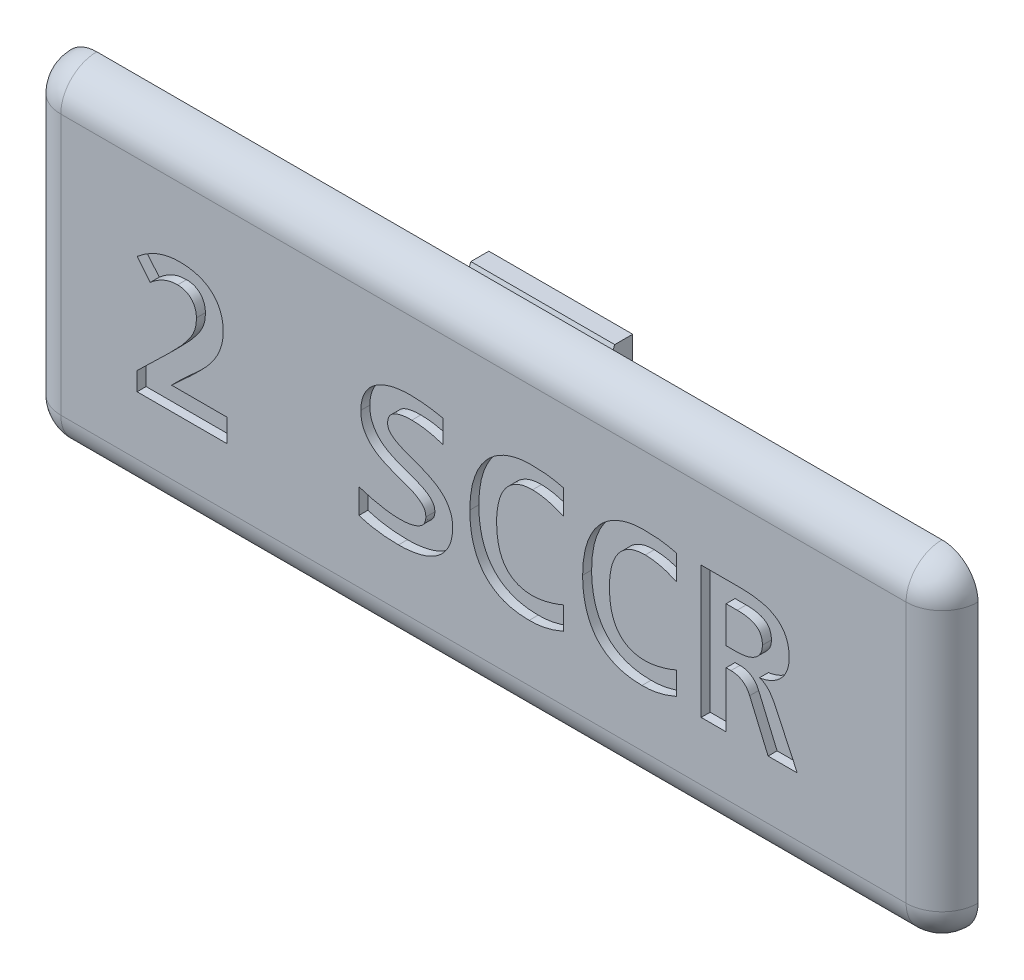
from build123d import *

# Parameters (mm, degrees)
BOSS_EXTRUDE1_DEPTH = 2
SKETCH3_W           = 47.5
SKETCH3_H           = 15
BOSS_EXTRUDE2_DEPTH = 1
SKETCH4_W           = 9.5
SKETCH4_H           = 5
CUT_EXTRUDE1_DEPTH  = 1
SKETCH5_W           = 8
SKETCH5_H           = 8.5
CUT_EXTRUDE2_DEPTH  = 1
SKETCH6_W           = 4
SKETCH6_H           = 1.75
BOSS_EXTRUDE3_DEPTH = 1.75
BOSS_EXTRUDE4_DEPTH = 4
FILLET1_R           = 2
CUT_EXTRUDE3_DEPTH  = 0.5


with BuildPart() as part:
    # Sketch1 → Boss-Extrude1 (new body)
    with BuildSketch(Plane.XY):
        with BuildLine():
            Line((25.5, -7.25), (25.5, 7.25))
            ThreePointArc((25.5, 7.25), (24.914213562, 8.664213562), (23.5, 9.25))
            Line((23.5, 9.25), (-23.5, 9.25))
            ThreePointArc((-23.5, 9.25), (-24.914213562, 8.664213562), (-25.5, 7.25))
            Line((-25.5, 7.25), (-25.5, -7.25))
            ThreePointArc((-25.5, -7.25), (-24.914213562, -8.664213562), (-23.5, -9.25))
            Line((-23.5, -9.25), (23.5, -9.25))
            ThreePointArc((23.5, -9.25), (24.914213562, -8.664213562), (25.5, -7.25))
        make_face()
    extrude(amount=BOSS_EXTRUDE1_DEPTH)

    # Sketch3 → Boss-Extrude2 (add)
    with BuildSketch(Plane(origin=(0, 0, 0), x_dir=(-1, 0, 0), z_dir=(0, 0, -1))):
        Rectangle(SKETCH3_W, SKETCH3_H)
    extrude(amount=BOSS_EXTRUDE2_DEPTH)

    # Sketch4 → Cut-Extrude1 (cut)
    with BuildSketch(Plane(origin=(0, 0, -1), x_dir=(-1, 0, 0), z_dir=(0, 0, -1))):
        with Locations((-13.5, -5)):
            Rectangle(SKETCH4_W, SKETCH4_H)
    extrude(amount=-CUT_EXTRUDE1_DEPTH, mode=Mode.SUBTRACT)

    # Sketch5 → Cut-Extrude2 (cut)
    with BuildSketch(Plane(origin=(0, 0, -1), x_dir=(-1, 0, 0), z_dir=(0, 0, -1))):
        with Locations((-17, 3.5)):
            Rectangle(SKETCH5_W, SKETCH5_H)
    extrude(amount=-CUT_EXTRUDE2_DEPTH, mode=Mode.SUBTRACT)

    # Sketch6 → Boss-Extrude3 (add)
    with BuildSketch(Plane(origin=(0, 0, 0), x_dir=(-1, 0, 0), z_dir=(0, 0, -1))):
        with Locations((-13.5, -8.375)):
            Rectangle(SKETCH6_W, SKETCH6_H)
    extrude(amount=BOSS_EXTRUDE3_DEPTH)

    # Sketch8 → Boss-Extrude4 (add, symmetric)
    with BuildSketch(Plane(origin=(0, 0, 0), x_dir=(0, 0, -1), z_dir=(1, 0, 0))):
        Polygon((2.3, 6.05), (2.3, 8.25), (1.3, 8.25), (1, 7.5), (1, 5.25), align=None)
    boss_extrude4 = extrude(amount=BOSS_EXTRUDE4_DEPTH, both=True)

    # Mirror1: Boss-Extrude4 across plane
    add(boss_extrude4.mirror(Plane.ZX))

    # Fillet1
    fillet1_edges = [part.edges().sort_by_distance(p)[0] for p in [
        (-24.914213562, 8.664213562, 2),
        (0, 9.25, 2),
        (24.914213562, 8.664213562, 2),
        (25.5, 0, 2),
        (24.914213562, -8.664213562, 2),
        (0, -9.25, 2),
        (-24.914213562, -8.664213562, 2),
        (-25.5, 0, 2),
    ]]
    fillet(fillet1_edges, radius=FILLET1_R - 0.0001)  # a hair under: the kernel refuses the full size

    # Sketch9 → Cut-Extrude3 (cut)
    # profile 1 of 5: a face of its own
    with BuildSketch(Plane.XY.offset(2)):
        with BuildLine():
            Line((-19.255769503, -4), (-19.255769503, -2.975021838))
            Line((-19.255769503, -2.975021838), (-17.488222072, -1.262294957))
            add(Edge.make_bspline(
                [(-17.488222072, -1.262294957), (-17.408512475, -1.184736949), (-17.25609823, -1.036436799), (-17.04620223, -0.816038676), (-16.857569206, -0.61579137), (-16.692830868, -0.430258468), (-16.550903966, -0.25597962), (-16.426016432, -0.093280397), (-16.317339974, 0.058934106), (-16.226730139, 0.203339034), (-16.150750059, 0.339856641), (-16.091267191, 0.471346182), (-16.04359918, 0.596499071), (-15.999147049, 0.757701745), (-15.968297934, 0.961452613), (-15.962708819, 1.125342467), (-15.959891587, 1.207952251)],
                knots=[0, 0, 0, 0, 1.561346149, 2.985479849, 4.272660798, 5.42387168, 6.4681479, 7.427594435, 8.303382019, 9.092890023, 9.820107477, 10.495077279, 11.117492523, 11.698467986, 12.839897307, 14, 14, 14, 14], degree=3))
            add(Edge.make_bspline(
                [(-15.959891587, 1.207952251), (-15.962836968, 1.278627209), (-15.968670273, 1.41859843), (-16.02240523, 1.619519799), (-16.103309123, 1.804786474), (-16.222849723, 1.963317524), (-16.372035497, 2.096953909), (-16.523241866, 2.179089991), (-16.658179036, 2.226849085), (-16.768441533, 2.253103132), (-16.885742125, 2.270659145), (-16.966528547, 2.272072263), (-17.008126953, 2.272799904)],
                knots=[0, 0, 0, 0, 1.259052347, 2.493543675, 3.687736162, 4.846054809, 6.008246034, 7.237941048, 7.888132915, 8.5593184, 9.258166694, 10, 10, 10, 10], degree=3))
            add(Edge.make_bspline(
                [(-17.008126953, 2.272799904), (-17.07966446, 2.270329873), (-17.220667058, 2.265461367), (-17.428239933, 2.233895027), (-17.627602462, 2.17845533), (-17.818518528, 2.100740605), (-18.004146757, 2.007422495), (-18.182855934, 1.896708444), (-18.358713065, 1.774313557), (-18.469025969, 1.681724921), (-18.524828836, 1.634888049)],
                knots=[0, 0, 0, 0, 1.020414048, 2.011267059, 2.986668027, 3.96497488, 4.94697347, 5.946696085, 6.961316025, 8, 8, 8, 8], degree=3))
            Line((-18.524828836, 1.634888049), (-19.255769503, 2.517000536))
            add(Edge.make_bspline(
                [(-19.255769503, 2.517000536), (-19.174306424, 2.584799162), (-19.011350225, 2.720421417), (-18.747348837, 2.900070446), (-18.467969852, 3.057503592), (-18.174788478, 3.194494077), (-17.867885602, 3.307820257), (-17.545366431, 3.383870951), (-17.211329504, 3.435073377), (-16.983959709, 3.439870653), (-16.868583734, 3.442304971)],
                knots=[0, 0, 0, 0, 0.971414743, 1.943187718, 2.923163908, 3.90905488, 4.908116413, 5.916732171, 6.942871654, 8, 8, 8, 8], degree=3))
            add(Edge.make_bspline(
                [(-16.868583734, 3.442304971), (-16.780464639, 3.440928405), (-16.60768234, 3.438229261), (-16.355097125, 3.410674101), (-16.115093085, 3.368095181), (-15.888303368, 3.308310406), (-15.675146032, 3.232199207), (-15.476692718, 3.139401572), (-15.294430627, 3.029347585), (-15.128773554, 2.902473118), (-14.980105791, 2.758572482), (-14.847399489, 2.598289975), (-14.734897023, 2.419600413), (-14.63976189, 2.225289815), (-14.562283946, 2.015905691), (-14.510943158, 1.789660664), (-14.475676526, 1.549059121), (-14.472873157, 1.383072388), (-14.471430593, 1.297658605)],
                knots=[0, 0, 0, 0, 1.159472778, 2.273472863, 3.340013536, 4.365414322, 5.356781803, 6.31537468, 7.244130825, 8.153815157, 9.055875647, 9.962049253, 10.886103095, 11.828148954, 12.805810483, 13.817047342, 14.876691883, 16, 16, 16, 16], degree=3))
            add(Edge.make_bspline(
                [(-14.471430593, 1.297658605), (-14.472340223, 1.226144689), (-14.474136361, 1.084934568), (-14.499436133, 0.87698456), (-14.534071104, 0.675358345), (-14.588950496, 0.48156233), (-14.655613997, 0.292930978), (-14.735588564, 0.10727034), (-14.831208024, -0.074852326), (-14.937512587, -0.256575519), (-15.057181278, -0.436836133), (-15.193524963, -0.613819137), (-15.338921567, -0.794474225), (-15.500893997, -0.97302654), (-15.675317642, -1.153679186), (-15.856851653, -1.343194352), (-16.055314219, -1.532404245), (-16.191292774, -1.66050852), (-16.260573998, -1.725777789)],
                knots=[0, 0, 0, 0, 0.945736526, 1.867434716, 2.768631143, 3.650402628, 4.528787893, 5.414963327, 6.32280855, 7.249039709, 8.200182995, 9.183579422, 10.204429958, 11.268168642, 12.372135405, 13.527717836, 14.740369513, 16, 16, 16, 16], degree=3))
            Line((-16.260573998, -1.725777789), (-17.342033939, -2.724176291))
            Line((-17.342033939, -2.724176291), (-14.258793308, -2.724176291))
            Line((-14.258793308, -2.724176291), (-14.258793308, -4))
            Line((-14.258793308, -4), (-19.255769503, -4))
        make_face()
    # profile 2 of 5: a face of its own
    with BuildSketch(Plane.XY.offset(2)):
        with BuildLine():
            add(Edge.make_bspline(
                [(-1.713193501, -1.772292195), (-1.715233027, -1.86883922), (-1.719193694, -2.056329111), (-1.76456463, -2.327452066), (-1.832762425, -2.580211484), (-1.931851129, -2.812595013), (-2.055559882, -3.024552799), (-2.201396602, -3.217804638), (-2.369960467, -3.391303509), (-2.561057485, -3.544437546), (-2.771652397, -3.679455981), (-3.001453676, -3.795948339), (-3.251311274, -3.891826562), (-3.517936509, -3.971067083), (-3.800658831, -4.032295381), (-4.097155575, -4.074474411), (-4.406621897, -4.102272544), (-4.617512739, -4.104952633), (-4.725001294, -4.106318642)],
                knots=[0, 0, 0, 0, 1.073681499, 2.085040185, 3.051149047, 3.981944283, 4.887978953, 5.776845786, 6.670466122, 7.573455289, 8.49677068, 9.450589821, 10.436166866, 11.471749255, 12.544173733, 13.653021529, 14.803772988, 16, 16, 16, 16], degree=3))
            add(Edge.make_bspline(
                [(-4.725001294, -4.106318642), (-4.915614486, -4.102798045), (-5.291554785, -4.095854484), (-5.847807662, -4.040981544), (-6.39253871, -3.942410694), (-6.745288718, -3.83926823), (-6.92280698, -3.787362715)],
                knots=[0, 0, 0, 0, 1.025764599, 2.023082686, 3.005134181, 4, 4, 4, 4], degree=3))
            Line((-6.92280698, -3.787362715), (-6.92280698, -2.405220363))
            add(Edge.make_bspline(
                [(-6.92280698, -2.405220363), (-6.833194946, -2.433752405), (-6.651247326, -2.491683655), (-6.373987719, -2.573947282), (-6.089179773, -2.643700599), (-5.802658794, -2.707893455), (-5.515483022, -2.758875756), (-5.230310999, -2.799365289), (-4.949748281, -2.825427735), (-4.764369425, -2.828828163), (-4.673503201, -2.830494933)],
                knots=[0, 0, 0, 0, 0.982138956, 1.994127776, 3.019379675, 4.043652595, 5.060010385, 6.064286964, 7.051181246, 8, 8, 8, 8], degree=3))
            add(Edge.make_bspline(
                [(-4.673503201, -2.830494933), (-4.60925134, -2.830041177), (-4.486167432, -2.82917194), (-4.308685604, -2.817522363), (-4.146813448, -2.797713359), (-3.99841215, -2.771659209), (-3.864938101, -2.736600061), (-3.74354992, -2.697026889), (-3.63584851, -2.650592558), (-3.539569694, -2.599216546), (-3.457062112, -2.541104792), (-3.385200234, -2.479147037), (-3.326842052, -2.41049185), (-3.264639214, -2.31293006), (-3.212644507, -2.175714647), (-3.205354658, -2.060183021), (-3.201654495, -2.001541768)],
                knots=[0, 0, 0, 0, 1.428616996, 2.73672639, 3.952495327, 5.053878092, 6.0842745, 7.018828766, 7.890331589, 8.689308687, 9.440856164, 10.130100935, 10.793906804, 11.436117796, 12.698631087, 14, 14, 14, 14], degree=3))
            add(Edge.make_bspline(
                [(-3.201654495, -2.001541768), (-3.203654865, -1.958771597), (-3.207546134, -1.875571834), (-3.235337867, -1.755432625), (-3.286848579, -1.647416226), (-3.356182013, -1.550251705), (-3.441638553, -1.462276945), (-3.536744971, -1.376740422), (-3.648540437, -1.301439577), (-3.813457809, -1.201559554), (-4.046762146, -1.089822564), (-4.353324012, -0.977026591), (-4.677987751, -0.863142475), (-5.011825054, -0.742734921), (-5.344079319, -0.604190817), (-5.618909124, -0.480251865), (-5.830295789, -0.36590432), (-5.979520777, -0.26961421), (-6.120127413, -0.163700793), (-6.253528902, -0.050172024), (-6.375319735, 0.076312692), (-6.483114552, 0.215194346), (-6.580596385, 0.364229564), (-6.665806043, 0.5253021), (-6.735490144, 0.701900771), (-6.782405313, 0.895267416), (-6.810964062, 1.105210511), (-6.814600779, 1.25049351), (-6.816488338, 1.325899495)],
                knots=[0, 0, 0, 0, 0.628577789, 1.222756944, 1.798018064, 2.376093337, 2.969100815, 3.597678604, 4.252424917, 4.946124793, 6.431204757, 8.043936516, 9.745465074, 11.488681512, 13.25853968, 15.035457213, 15.916880054, 16.788288763, 17.642849837, 18.502665518, 19.360321436, 20.218324825, 21.082903639, 21.974822425, 22.892221362, 23.865363472, 24.892063288, 26, 26, 26, 26], degree=3))
            add(Edge.make_bspline(
                [(-6.816488338, 1.325899495), (-6.814677983, 1.396899448), (-6.81109741, 1.537325268), (-6.779301757, 1.744578619), (-6.732185213, 1.94709667), (-6.661993259, 2.142380693), (-6.572896903, 2.330295573), (-6.45836874, 2.505213834), (-6.32339806, 2.669490324), (-6.163880377, 2.819446715), (-5.981962022, 2.956357854), (-5.775612689, 3.077128365), (-5.547240693, 3.186132933), (-5.293180526, 3.27637227), (-5.014319785, 3.352603328), (-4.707642475, 3.403362452), (-4.374177679, 3.438208093), (-4.142563975, 3.44090476), (-4.022301516, 3.442304971)],
                knots=[0, 0, 0, 0, 0.86106195, 1.703033948, 2.539139973, 3.380790137, 4.216301896, 5.056905248, 5.911254958, 6.790607679, 7.707171391, 8.668295362, 9.687250551, 10.773449095, 11.935660323, 13.190638171, 14.54127474, 16, 16, 16, 16], degree=3))
            add(Edge.make_bspline(
                [(-4.022301516, 3.442304971), (-3.947526177, 3.441212585), (-3.794545853, 3.438977711), (-3.562482704, 3.424728832), (-3.3269951, 3.405528791), (-3.093355447, 3.37840904), (-2.865021743, 3.347628146), (-2.645999032, 3.310337834), (-2.439472029, 3.273976103), (-2.307811674, 3.244011532), (-2.244786713, 3.229667686)],
                knots=[0, 0, 0, 0, 1.000632186, 2.047159369, 3.110551158, 4.162103459, 5.194366354, 6.193323381, 7.135155576, 8, 8, 8, 8], degree=3))
            Line((-2.244786713, 3.229667686), (-2.244786713, 1.953843976))
            add(Edge.make_bspline(
                [(-2.244786713, 1.953843976), (-2.307699226, 1.976638887), (-2.437996654, 2.02384918), (-2.64237069, 2.083612661), (-2.858228133, 2.139088539), (-3.082399583, 2.184375354), (-3.311096004, 2.223247434), (-3.539547555, 2.250317419), (-3.76279106, 2.270577425), (-3.909294908, 2.27207115), (-3.980770797, 2.272799904)],
                knots=[0, 0, 0, 0, 0.905300762, 1.874958649, 2.879989676, 3.920459461, 4.968805495, 6.018141936, 7.033096622, 8, 8, 8, 8], degree=3))
            add(Edge.make_bspline(
                [(-3.980770797, 2.272799904), (-4.039494833, 2.272389091), (-4.152639542, 2.27159757), (-4.31501932, 2.259293716), (-4.463951016, 2.242252446), (-4.598430671, 2.214824371), (-4.72093559, 2.184100685), (-4.830644173, 2.145519451), (-4.930089415, 2.10263298), (-5.017746418, 2.052694949), (-5.095715439, 1.998747048), (-5.159385349, 1.934970283), (-5.21504554, 1.868264099), (-5.26993136, 1.768647923), (-5.318691272, 1.631342363), (-5.324855855, 1.515217838), (-5.328027344, 1.45547534)],
                knots=[0, 0, 0, 0, 1.388230333, 2.674729552, 3.848979118, 4.930101904, 5.917823404, 6.833012122, 7.677256906, 8.474713018, 9.216010271, 9.910495862, 10.599653, 11.262301414, 12.591538262, 14, 14, 14, 14], degree=3))
            add(Edge.make_bspline(
                [(-5.328027344, 1.45547534), (-5.326140309, 1.418174266), (-5.322476867, 1.345758875), (-5.292841221, 1.241254428), (-5.244216499, 1.14496574), (-5.174135585, 1.058742341), (-5.0895785, 0.979081521), (-4.993264051, 0.902275726), (-4.882776874, 0.83164487), (-4.716935667, 0.738595927), (-4.483141394, 0.633682813), (-4.179215829, 0.515750977), (-3.852427598, 0.403089781), (-3.51888139, 0.274869482), (-3.183158369, 0.138552943), (-2.911012928, 0.005444147), (-2.699270575, -0.110275923), (-2.550153937, -0.208418222), (-2.40942641, -0.315837742), (-2.277071103, -0.431003405), (-2.154457389, -0.556327431), (-2.044300439, -0.692798283), (-1.948190949, -0.841233473), (-1.86402334, -1.000219255), (-1.795019176, -1.171685328), (-1.746923831, -1.358660404), (-1.718929065, -1.560463106), (-1.715145096, -1.700214789), (-1.713193501, -1.772292195)],
                knots=[0, 0, 0, 0, 0.557156268, 1.081649532, 1.611348813, 2.159818371, 2.733894156, 3.347031838, 3.999468898, 4.692937397, 6.19005387, 7.82657883, 9.568786128, 11.359307707, 13.171290529, 14.986394118, 15.88741221, 16.778746798, 17.653416553, 18.53387112, 19.400741367, 20.27258301, 21.152453011, 22.041629961, 22.959843454, 23.910073311, 24.922113205, 26, 26, 26, 26], degree=3))
        make_face()
    # profile 3 of 5: a face of its own
    with BuildSketch(Plane.XY.offset(2)):
        with BuildLine():
            add(Edge.make_bspline(
                [(4.45328776, -3.681044073), (4.372217974, -3.715651713), (4.213161544, -3.78355084), (3.972748056, -3.869639406), (3.736722457, -3.943199485), (3.502831276, -4.003376747), (3.268503599, -4.051305953), (3.030754934, -4.081278545), (2.788575749, -4.102804536), (2.625431912, -4.105137879), (2.542874654, -4.106318642)],
                knots=[0, 0, 0, 0, 1.072602722, 2.104413604, 3.106297595, 4.08050826, 5.042709706, 6.014913564, 6.995467464, 8, 8, 8, 8], degree=3))
            add(Edge.make_bspline(
                [(2.542874654, -4.106318642), (2.413728184, -4.103492024), (2.162983726, -4.098004001), (1.79763062, -4.05421812), (1.455509278, -3.981881344), (1.135407943, -3.880896975), (0.839698664, -3.74894936), (0.566976326, -3.588758587), (0.317755098, -3.400288826), (0.093762938, -3.182517542), (-0.105393212, -2.936959921), (-0.276462504, -2.661403863), (-0.424786984, -2.360128288), (-0.545975999, -2.030430302), (-0.640277326, -1.673279527), (-0.707095612, -1.288682645), (-0.749812595, -0.876744797), (-0.754110337, -0.592930873), (-0.756325719, -0.446631622)],
                knots=[0, 0, 0, 0, 1.102605573, 2.140764961, 3.136846793, 4.08496906, 5.001529512, 5.896051515, 6.780328523, 7.66316301, 8.557497515, 9.473264751, 10.427030373, 11.420482266, 12.467702166, 13.577100782, 14.751053738, 16, 16, 16, 16], degree=3))
            add(Edge.make_bspline(
                [(-0.756325719, -0.446631622), (-0.753667796, -0.296438203), (-0.748486532, -0.003656335), (-0.702160165, 0.422129627), (-0.631194587, 0.823413824), (-0.525440088, 1.197531333), (-0.395354931, 1.546322967), (-0.23652584, 1.866121809), (-0.055632105, 2.159862228), (0.153437343, 2.423544911), (0.386576277, 2.659138786), (0.644713649, 2.864478875), (0.924700837, 3.042084351), (1.22970337, 3.18668041), (1.555545965, 3.300804906), (1.901435568, 3.384664843), (2.267413645, 3.432723431), (2.517816106, 3.439062962), (2.645870839, 3.442304971)],
                knots=[0, 0, 0, 0, 1.232307787, 2.402218284, 3.511138658, 4.573037126, 5.588482404, 6.562047137, 7.499038646, 8.414657469, 9.317692522, 10.213424542, 11.116219401, 12.033010505, 12.977368732, 13.94518829, 14.949178196, 16, 16, 16, 16], degree=3))
            add(Edge.make_bspline(
                [(2.645870839, 3.442304971), (2.727839596, 3.442379303), (2.886840555, 3.442523492), (3.119358272, 3.432355728), (3.342375572, 3.423315248), (3.560391528, 3.399418422), (3.778025589, 3.373138858), (3.997853534, 3.33205503), (4.224403065, 3.289945185), (4.375983186, 3.250026087), (4.45328776, 3.229667686)],
                knots=[0, 0, 0, 0, 1.077376558, 2.089868288, 3.059369192, 4.010411707, 4.972009834, 5.940198088, 6.949518525, 8, 8, 8, 8], degree=3))
            Line((4.45328776, 3.229667686), (4.45328776, 1.847525334))
            add(Edge.make_bspline(
                [(4.45328776, 1.847525334), (4.373946173, 1.883908699), (4.218583533, 1.955152746), (3.983416207, 2.04394639), (3.755143128, 2.120277488), (3.53189074, 2.175420359), (3.318020652, 2.21935258), (3.112736965, 2.248995054), (2.917569989, 2.268267408), (2.7904383, 2.271322067), (2.728932278, 2.272799904)],
                knots=[0, 0, 0, 0, 1.170030163, 2.291093263, 3.368831198, 4.395296508, 5.372370687, 6.295361994, 7.175300008, 8, 8, 8, 8], degree=3))
            add(Edge.make_bspline(
                [(2.728932278, 2.272799904), (2.643533004, 2.27071407), (2.478614608, 2.266686021), (2.240437809, 2.231648306), (2.021545776, 2.172374666), (1.822203654, 2.08841263), (1.640760132, 1.984052988), (1.475143446, 1.861337692), (1.328315735, 1.716704966), (1.198336054, 1.554716953), (1.084692277, 1.375038531), (0.987167081, 1.178986948), (0.905265096, 0.966562601), (0.841699666, 0.738750149), (0.791830967, 0.497822889), (0.757970043, 0.244643479), (0.735263199, -0.019834089), (0.733191739, -0.200166262), (0.732135275, -0.292137345)],
                knots=[0, 0, 0, 0, 1.109729706, 2.143049175, 3.121026665, 4.050204485, 4.946654748, 5.836403406, 6.722153568, 7.618170183, 8.530804457, 9.480502004, 10.460411604, 11.48580219, 12.551706219, 13.656287425, 14.804684813, 16, 16, 16, 16], degree=3))
            add(Edge.make_bspline(
                [(0.732135275, -0.292137345), (0.732967869, -0.389108251), (0.734592834, -0.578365433), (0.760041659, -0.853722278), (0.792682067, -1.114433872), (0.844523514, -1.35809311), (0.909855882, -1.585438087), (0.99385864, -1.794112454), (1.09109911, -1.986543156), (1.206539657, -2.160422771), (1.337983831, -2.316818706), (1.488654779, -2.451462953), (1.655337671, -2.5676376), (1.838994972, -2.664747876), (2.041365823, -2.739263874), (2.261119877, -2.791527194), (2.498028958, -2.826230809), (2.662352053, -2.829042844), (2.747205795, -2.830494933)],
                knots=[0, 0, 0, 0, 1.256876421, 2.453033611, 3.583260076, 4.661975506, 5.679853963, 6.646528144, 7.574590913, 8.470745685, 9.346915849, 10.216322401, 11.082788599, 11.975686973, 12.902638023, 13.870910894, 14.900573425, 16, 16, 16, 16], degree=3))
            add(Edge.make_bspline(
                [(2.747205795, -2.830494933), (2.812631955, -2.828899674), (2.948967401, -2.825575464), (3.159104265, -2.796657186), (3.377766428, -2.755402575), (3.601336587, -2.704040956), (3.824130367, -2.641187625), (4.043316784, -2.568293444), (4.253261032, -2.489921555), (4.38813096, -2.432810969), (4.45328776, -2.405220363)],
                knots=[0, 0, 0, 0, 0.887372101, 1.849111607, 2.873273884, 3.906654629, 4.960374994, 6.012916101, 7.040022999, 8, 8, 8, 8], degree=3))
            Line((4.45328776, -2.405220363), (4.45328776, -3.681044073))
        make_face()
    # profile 4 of 5: a face of its own
    with BuildSketch(Plane.XY.offset(2)):
        with BuildLine():
            add(Edge.make_bspline(
                [(10.726087664, -3.681044073), (10.645017878, -3.715651713), (10.485961448, -3.78355084), (10.24554796, -3.869639406), (10.009522361, -3.943199485), (9.77563118, -4.003376747), (9.541303503, -4.051305953), (9.303554838, -4.081278545), (9.061375653, -4.102804536), (8.898231816, -4.105137879), (8.815674558, -4.106318642)],
                knots=[0, 0, 0, 0, 1.072602722, 2.104413604, 3.106297595, 4.08050826, 5.042709706, 6.014913564, 6.995467464, 8, 8, 8, 8], degree=3))
            add(Edge.make_bspline(
                [(8.815674558, -4.106318642), (8.686528088, -4.103492024), (8.435783629, -4.098004001), (8.070430524, -4.05421812), (7.728309182, -3.981881344), (7.408207847, -3.880896975), (7.112498568, -3.74894936), (6.83977623, -3.588758587), (6.590555002, -3.400288826), (6.366562841, -3.182517542), (6.167406691, -2.936959921), (5.996337399, -2.661403863), (5.84801292, -2.360128288), (5.726823905, -2.030430302), (5.632522578, -1.673279527), (5.565704292, -1.288682645), (5.522987308, -0.876744797), (5.518689567, -0.592930873), (5.516474185, -0.446631622)],
                knots=[0, 0, 0, 0, 1.102605573, 2.140764961, 3.136846793, 4.08496906, 5.001529512, 5.896051515, 6.780328523, 7.66316301, 8.557497515, 9.473264751, 10.427030373, 11.420482266, 12.467702166, 13.577100782, 14.751053738, 16, 16, 16, 16], degree=3))
            add(Edge.make_bspline(
                [(5.516474185, -0.446631622), (5.519132108, -0.296438203), (5.524313372, -0.003656335), (5.570639739, 0.422129627), (5.641605317, 0.823413824), (5.747359816, 1.197531333), (5.877444973, 1.546322967), (6.036274064, 1.866121809), (6.217167799, 2.159862228), (6.426237247, 2.423544911), (6.659376181, 2.659138786), (6.917513553, 2.864478875), (7.19750074, 3.042084351), (7.502503274, 3.18668041), (7.828345869, 3.300804906), (8.174235472, 3.384664843), (8.540213549, 3.432723431), (8.79061601, 3.439062962), (8.918670743, 3.442304971)],
                knots=[0, 0, 0, 0, 1.232307787, 2.402218284, 3.511138658, 4.573037126, 5.588482404, 6.562047137, 7.499038646, 8.414657469, 9.317692522, 10.213424542, 11.116219401, 12.033010505, 12.977368732, 13.94518829, 14.949178196, 16, 16, 16, 16], degree=3))
            add(Edge.make_bspline(
                [(8.918670743, 3.442304971), (9.0006395, 3.442379303), (9.159640459, 3.442523492), (9.392158176, 3.432355728), (9.615175476, 3.423315248), (9.833191432, 3.399418422), (10.050825493, 3.373138858), (10.270653438, 3.33205503), (10.497202969, 3.289945185), (10.64878309, 3.250026087), (10.726087664, 3.229667686)],
                knots=[0, 0, 0, 0, 1.077376558, 2.089868288, 3.059369192, 4.010411707, 4.972009834, 5.940198088, 6.949518525, 8, 8, 8, 8], degree=3))
            Line((10.726087664, 3.229667686), (10.726087664, 1.847525334))
            add(Edge.make_bspline(
                [(10.726087664, 1.847525334), (10.646746077, 1.883908699), (10.491383437, 1.955152746), (10.256216111, 2.04394639), (10.027943032, 2.120277488), (9.804690643, 2.175420359), (9.590820555, 2.21935258), (9.385536869, 2.248995054), (9.190369893, 2.268267408), (9.063238204, 2.271322067), (9.001732182, 2.272799904)],
                knots=[0, 0, 0, 0, 1.170030163, 2.291093263, 3.368831198, 4.395296508, 5.372370687, 6.295361994, 7.175300008, 8, 8, 8, 8], degree=3))
            add(Edge.make_bspline(
                [(9.001732182, 2.272799904), (8.916332908, 2.27071407), (8.751414511, 2.266686021), (8.513237712, 2.231648306), (8.29434568, 2.172374666), (8.095003558, 2.08841263), (7.913560035, 1.984052988), (7.74794335, 1.861337692), (7.601115638, 1.716704966), (7.471135958, 1.554716953), (7.35749218, 1.375038531), (7.259966985, 1.178986948), (7.178065, 0.966562601), (7.11449957, 0.738750149), (7.064630871, 0.497822889), (7.030769947, 0.244643479), (7.008063103, -0.019834089), (7.005991643, -0.200166262), (7.004935179, -0.292137345)],
                knots=[0, 0, 0, 0, 1.109729706, 2.143049175, 3.121026665, 4.050204485, 4.946654748, 5.836403406, 6.722153568, 7.618170183, 8.530804457, 9.480502004, 10.460411604, 11.48580219, 12.551706219, 13.656287425, 14.804684813, 16, 16, 16, 16], degree=3))
            add(Edge.make_bspline(
                [(7.004935179, -0.292137345), (7.005767772, -0.389108251), (7.007392737, -0.578365433), (7.032841562, -0.853722278), (7.065481971, -1.114433872), (7.117323418, -1.35809311), (7.182655786, -1.585438087), (7.266658544, -1.794112454), (7.363899014, -1.986543156), (7.479339561, -2.160422771), (7.610783735, -2.316818706), (7.761454683, -2.451462953), (7.928137575, -2.5676376), (8.111794876, -2.664747876), (8.314165727, -2.739263874), (8.53391978, -2.791527194), (8.770828861, -2.826230809), (8.935151957, -2.829042844), (9.020005699, -2.830494933)],
                knots=[0, 0, 0, 0, 1.256876421, 2.453033611, 3.583260076, 4.661975506, 5.679853963, 6.646528144, 7.574590913, 8.470745685, 9.346915849, 10.216322401, 11.082788599, 11.975686973, 12.902638023, 13.870910894, 14.900573425, 16, 16, 16, 16], degree=3))
            add(Edge.make_bspline(
                [(9.020005699, -2.830494933), (9.085431859, -2.828899674), (9.221767305, -2.825575464), (9.431904169, -2.796657186), (9.650566332, -2.755402575), (9.874136491, -2.704040956), (10.096930271, -2.641187625), (10.316116688, -2.568293444), (10.526060936, -2.489921555), (10.660930864, -2.432810969), (10.726087664, -2.405220363)],
                knots=[0, 0, 0, 0, 0.887372101, 1.849111607, 2.873273884, 3.906654629, 4.960374994, 6.012916101, 7.040022999, 8, 8, 8, 8], degree=3))
            Line((10.726087664, -2.405220363), (10.726087664, -3.681044073))
        make_face()
    # profile 5 of 5: a face of its own
    with BuildSketch(Plane.XY.offset(2)):
        with BuildLine():
            Line((15.829382501, -4), (14.804404339, -1.606169316))
            add(Edge.make_bspline(
                [(14.804404339, -1.606169316), (14.779460599, -1.551560995), (14.73099014, -1.445446581), (14.632886218, -1.304923819), (14.520963779, -1.184858891), (14.392757541, -1.087875148), (14.252406254, -1.010820377), (14.099099547, -0.955020147), (13.933499481, -0.924044981), (13.81941853, -0.91922244), (13.76115266, -0.916759369)],
                knots=[0, 0, 0, 0, 1.07937985, 2.097441539, 3.071055259, 4.024539089, 4.97969058, 5.945096662, 6.95047571, 8, 8, 8, 8], degree=3))
            Line((13.76115266, -0.916759369), (13.490372368, -0.916759369))
            Line((13.490372368, -0.916759369), (13.490372368, -4))
            Line((13.490372368, -4), (12.108230016, -4))
            Line((12.108230016, -4), (12.108230016, 3.335986328))
            Line((12.108230016, 3.335986328), (14.284439728, 3.335986328))
            add(Edge.make_bspline(
                [(14.284439728, 3.335986328), (14.385239514, 3.334558203), (14.582024792, 3.33177016), (14.869980409, 3.314507122), (15.142571932, 3.280355035), (15.400931983, 3.23678202), (15.643439528, 3.177654578), (15.868859081, 3.102221807), (16.074566864, 3.006751373), (16.261789897, 2.895060751), (16.431256532, 2.767544518), (16.578817671, 2.619467952), (16.705857208, 2.453509044), (16.81364176, 2.269510715), (16.896644607, 2.064631188), (16.95620659, 1.839219269), (16.993302183, 1.592367778), (16.996980303, 1.420173449), (16.998887568, 1.330883181)],
                knots=[0, 0, 0, 0, 1.254438722, 2.448964256, 3.587437174, 4.671603447, 5.707801299, 6.690588177, 7.624750448, 8.524079809, 9.399245701, 10.256818247, 11.116851234, 11.993805779, 12.902354155, 13.858471343, 14.889524007, 16, 16, 16, 16], degree=3))
            add(Edge.make_bspline(
                [(16.998887568, 1.330883181), (16.997231778, 1.266027698), (16.994008135, 1.139761161), (16.970695717, 0.955512005), (16.93094301, 0.782490816), (16.875946919, 0.620678219), (16.807311099, 0.469971709), (16.726109827, 0.329818696), (16.630380446, 0.200963764), (16.522568296, 0.083327798), (16.403745256, -0.022866842), (16.276691913, -0.120584195), (16.139125063, -0.206491695), (15.992374519, -0.28066425), (15.839567405, -0.346219442), (15.679689722, -0.39844254), (15.51453445, -0.442650533), (15.401513756, -0.462940622), (15.344303695, -0.473211283)],
                knots=[0, 0, 0, 0, 1.155349972, 2.249340124, 3.302347646, 4.313193118, 5.288908417, 6.248327119, 7.193487508, 8.143168254, 9.086215168, 10.029416886, 10.995709606, 11.970826185, 12.956664107, 13.955010984, 14.964844911, 16, 16, 16, 16], degree=3))
            add(Edge.make_bspline(
                [(15.344303695, -0.473211283), (15.388663804, -0.484841723), (15.478919204, -0.5085051), (15.60591461, -0.576550257), (15.728056084, -0.665064066), (15.844231011, -0.779239962), (15.955945376, -0.920394957), (16.068387043, -1.087983483), (16.179339873, -1.285151384), (16.248281151, -1.428002511), (16.284559189, -1.503173132)],
                knots=[0, 0, 0, 0, 0.75991202, 1.546122521, 2.376404305, 3.261596413, 4.243343524, 5.3639781, 6.612881775, 8, 8, 8, 8], degree=3))
            Line((16.284559189, -1.503173132), (17.44908057, -4))
            Line((17.44908057, -4), (15.829382501, -4))
        make_face()
        with BuildLine():
            add(Edge.make_bspline(
                [(15.510426574, 1.18137259), (15.509631991, 1.223508343), (15.508088357, 1.305365345), (15.491568818, 1.423597864), (15.462832905, 1.532551577), (15.425475948, 1.632271234), (15.376062634, 1.723132937), (15.314652668, 1.803901015), (15.242708245, 1.876239609), (15.159258847, 1.938225642), (15.066359281, 1.993062483), (14.961867848, 2.039395757), (14.847043984, 2.079627461), (14.72052339, 2.110126311), (14.58354943, 2.135262873), (14.435419027, 2.152973554), (14.276337715, 2.165182299), (14.166517367, 2.166039962), (14.110010705, 2.166481261)],
                knots=[0, 0, 0, 0, 1.03221539, 2.00528173, 2.91708139, 3.789130794, 4.609038712, 5.442315575, 6.267597059, 7.100873922, 7.98300273, 8.906244241, 9.897686097, 10.9608414, 12.092146654, 13.309174969, 14.615470257, 16, 16, 16, 16], degree=3))
            Line((14.110010705, 2.166481261), (13.490372368, 2.166481261))
            Line((13.490372368, 2.166481261), (13.490372368, 0.146427055))
            Line((13.490372368, 0.146427055), (14.063496299, 0.146427055))
            add(Edge.make_bspline(
                [(14.063496299, 0.146427055), (14.167812384, 0.149398433), (14.367684411, 0.15509166), (14.609596621, 0.196674424), (14.786164293, 0.244407579), (14.904701134, 0.292562688), (15.015047858, 0.34469923), (15.115189573, 0.406651435), (15.205671928, 0.476024524), (15.283724779, 0.555191143), (15.353055308, 0.640002535), (15.40989794, 0.734005413), (15.454378741, 0.835799617), (15.48863851, 0.944131172), (15.506327137, 1.060632159), (15.509033549, 1.140343917), (15.510426574, 1.18137259)],
                knots=[0, 0, 0, 0, 2.184691281, 4.185918933, 5.126368008, 6.012027286, 6.863184627, 7.681184451, 8.47504028, 9.246354907, 10.005704987, 10.765941227, 11.540044168, 12.329221459, 13.140028664, 14, 14, 14, 14], degree=3))
        make_face(mode=Mode.SUBTRACT)
    extrude(amount=-CUT_EXTRUDE3_DEPTH, mode=Mode.SUBTRACT)


solid = part.part
